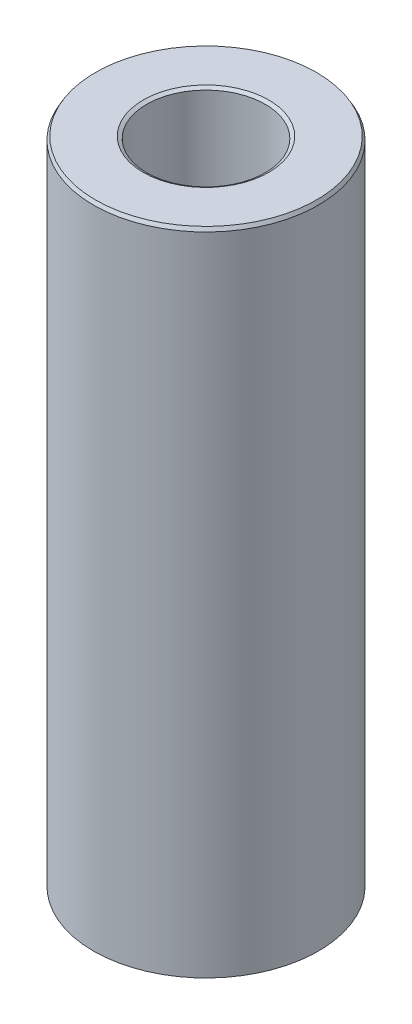
from build123d import *
from OCP.BRepFilletAPI import BRepFilletAPI_MakeChamfer

# Parameters (mm, degrees)
SKETCH1_R           = 45
BOSS_EXTRUDE1_DEPTH = 260.631117592
SKETCH2_R           = 23.730024487
CUT_EXTRUDE1_DEPTH  = 269.288239506
CHAMFER1_SIZE       = 1.381768615
CHAMFER1_SIZE2      = 0.797764482


with BuildPart() as part:
    # Sketch1 → Boss-Extrude1 (new body)
    with BuildSketch(Plane(origin=(0, 0, 0), x_dir=(1, 0, 0), z_dir=(0, 1, 0))):
        Circle(SKETCH1_R)
    extrude(amount=BOSS_EXTRUDE1_DEPTH)

    # Sketch2 → Cut-Extrude1 (cut, through all)
    with BuildSketch(Plane(origin=(0, 0, 0), x_dir=(1, 0, 0), z_dir=(0, 1, 0))):
        Circle(SKETCH2_R)
    extrude(amount=CUT_EXTRUDE1_DEPTH, mode=Mode.SUBTRACT)

    # Chamfer1: one chamfer whose edges measure the first distance from different faces: ONE call of the kernel's chamfer builder (chamfer() names one face for all edges)
    chamfer1_edges_1 = [part.edges().sort_by_distance(p)[0] for p in [
        (-23.730024487, 260.631117592, 0),
    ]]
    chamfer1_side_1 = [part.faces().sort_by_distance(p)[0] for p in [
        (-43.727207794, 260.631117592, 0),
    ]]
    chamfer1_edges_2 = [part.edges().sort_by_distance(p)[0] for p in [
        (-23.730024487, 0, 0),
    ]]
    chamfer1_side_2 = [part.faces().sort_by_distance(p)[0] for p in [
        (-23.730024487, 130.315558796, 0),
    ]]
    chamfer1_edges_3 = [part.edges().sort_by_distance(p)[0] for p in [
        (-45, 0, 0),
    ]]
    chamfer1_side_3 = [part.faces().sort_by_distance(p)[0] for p in [
        (-43.727207794, 0, 0),
    ]]
    chamfer1_edges_4 = [part.edges().sort_by_distance(p)[0] for p in [
        (-45, 260.631117592, 0),
    ]]
    chamfer1_side_4 = [part.faces().sort_by_distance(p)[0] for p in [
        (-45, 130.315558796, 0),
    ]]
    chamfer1 = BRepFilletAPI_MakeChamfer(part.part.solid().wrapped)
    for e in chamfer1_edges_1:
        chamfer1.Add(CHAMFER1_SIZE, CHAMFER1_SIZE2, e.wrapped, chamfer1_side_1[0].wrapped)  # the first distance lies on this face
    for e in chamfer1_edges_2:
        chamfer1.Add(CHAMFER1_SIZE, CHAMFER1_SIZE2, e.wrapped, chamfer1_side_2[0].wrapped)  # the first distance lies on this face
    for e in chamfer1_edges_3:
        chamfer1.Add(CHAMFER1_SIZE, CHAMFER1_SIZE2, e.wrapped, chamfer1_side_3[0].wrapped)  # the first distance lies on this face
    for e in chamfer1_edges_4:
        chamfer1.Add(CHAMFER1_SIZE, CHAMFER1_SIZE2, e.wrapped, chamfer1_side_4[0].wrapped)  # the first distance lies on this face
    add(Compound.cast(chamfer1.Shape()), mode=Mode.REPLACE)


solid = part.part
